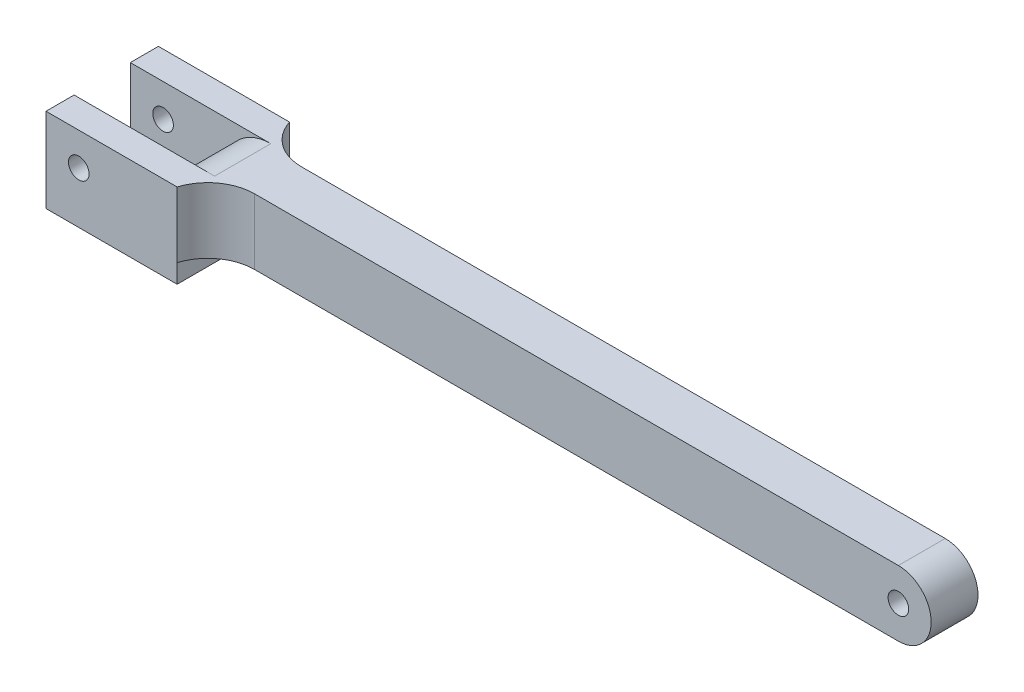
from build123d import *

# Parameters (mm, degrees)
SKETCH1_R           = 1.1
BOSS_EXTRUDE1_DEPTH = 5
SKETCH4_W           = 14
SKETCH4_H           = 12
BOSS_EXTRUDE3_DEPTH = 9
SKETCH5_W           = 10
SKETCH5_H           = 6
CUT_EXTRUDE2_DEPTH  = 9
CUT_EXTRUDE3_START  = 5
SKETCH7_R           = 1.1
CUT_EXTRUDE3_DEPTH  = 15
FILLET1_R           = 5
FILLET2_R           = 5


with BuildPart() as part:
    # Sketch1 → Boss-Extrude1 (new body)
    with BuildSketch(Plane.XY):
        with BuildLine():
            ThreePointArc((0, 3.5), (-3.5, 0), (0, -3.5))
            Line((0, -3.5), (83.5, -3.5))
            ThreePointArc((83.5, -3.5), (87, 0), (83.5, 3.5))
            Line((83.5, 3.5), (0, 3.5))
        make_face()
        Circle(SKETCH1_R, mode=Mode.SUBTRACT)
        with Locations((83.5, 0)):
            Circle(SKETCH1_R, mode=Mode.SUBTRACT)
    extrude(amount=BOSS_EXTRUDE1_DEPTH)

    # Sketch4 → Boss-Extrude3 (add)
    with BuildSketch(Plane(origin=(0, 3.5, 0), x_dir=(1, 0, 0), z_dir=(0, 1, 0))):
        with Locations((3, -2.5)):
            Rectangle(SKETCH4_W, SKETCH4_H)
    extrude(amount=-BOSS_EXTRUDE3_DEPTH)

    # Sketch5 → Cut-Extrude2 (cut)
    with BuildSketch(Plane.XZ.offset(5.5)):
        with Locations((1, 2.5)):
            Rectangle(SKETCH5_W, SKETCH5_H)
    extrude(amount=-CUT_EXTRUDE2_DEPTH, mode=Mode.SUBTRACT)

    # Sketch7 → Cut-Extrude3 (cut)
    with BuildSketch(Plane(origin=(0, 0, 0), x_dir=(-1, 0, 0), z_dir=(0, 0, -1)).offset(CUT_EXTRUDE3_START)):
        with Locations((0.5, 0)):
            Circle(SKETCH7_R)
    extrude(amount=-CUT_EXTRUDE3_DEPTH, mode=Mode.SUBTRACT)

    # Fillet1
    # the kernel refuses this fillet: 5 mm, written as the material it adds along each edge
    with BuildSketch(Plane(origin=(10, 3.5, 5), x_dir=(0, 0, 1), z_dir=(0, -1, 0))) as fillet1_piece_1:
        with BuildLine():
            CenterArc((5, -4.769696007), FILLET1_R, 107.457603124, 72.542396876)
            Line((0, -4.769696007), (-0.1, -4.769696007))
            Line((-0.1, -4.769696007), (-0.1, 0))
            Line((-0.1, 0), (0, 0.1))
            ThreePointArc((0, 0.1), (1.75, 0.1), (3.47, 0.09539392))
            Line((3.47, 0.09539392), (3.5, 0))
        make_face()
    extrude(amount=7)
    with BuildSketch(Plane(origin=(10, 3.5, 0), x_dir=(1, 0, 0), z_dir=(0, -1, 0))) as fillet1_piece_2:
        with BuildLine():
            CenterArc((4.769696007, -5), FILLET1_R, 90, 72.542396876)
            Line((0, -3.5), (-0.09539392, -3.47))
            ThreePointArc((-0.09539392, -3.47), (-0.1, -1.75), (-0.1, 0))
            Line((-0.1, 0), (0, 0.1))
            Line((0, 0.1), (4.769696007, 0.1))
            Line((4.769696007, 0.1), (4.769696007, 0))
        make_face()
    extrude(amount=7)

    # Fillet2
    fillet2_edges = [part.edges().sort_by_distance(p)[0] for p in [
        (6, 3.5, 2.5),
    ]]
    fillet(fillet2_edges, radius=FILLET2_R)


solid = part.part
